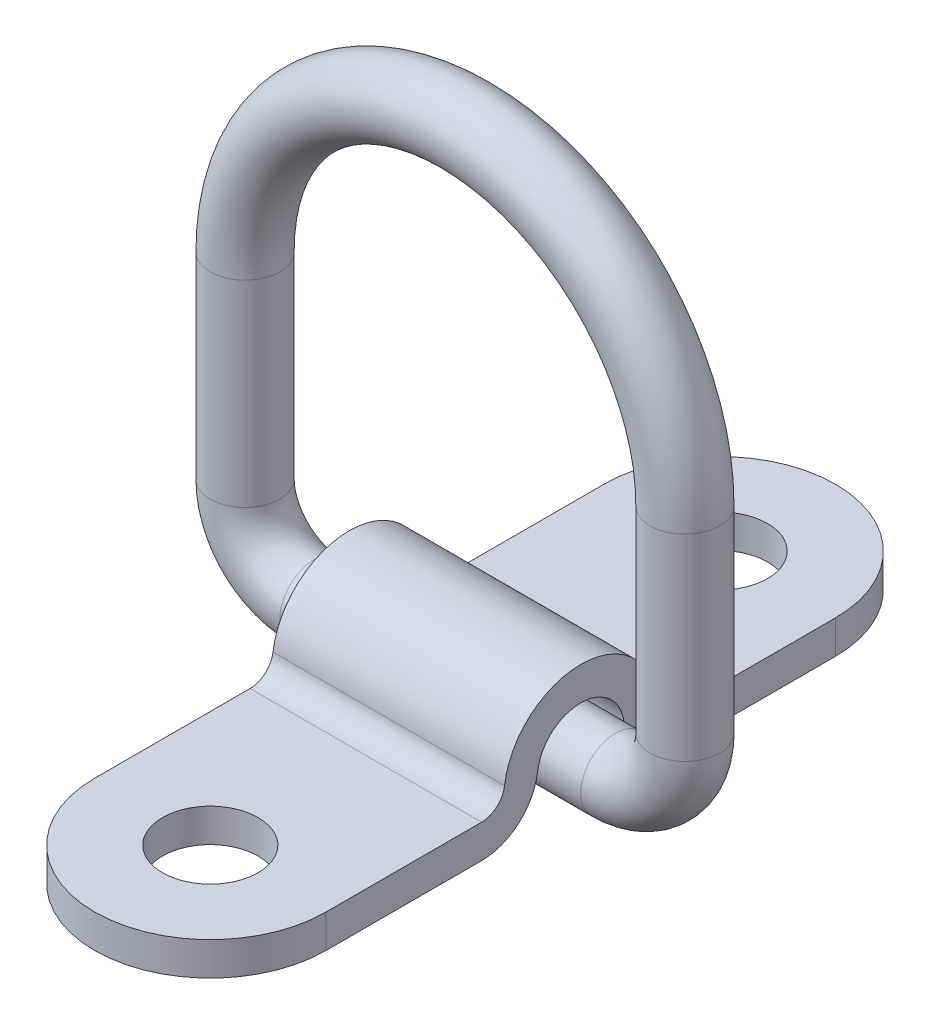
from build123d import *

# Parameters (mm, degrees)
SKETCH2_R           = 2.38125
BOSS_EXTRUDE1_DEPTH = 7.9375
SKETCH4_R           = 3.2766
CUT_EXTRUDE1_DEPTH  = 50.477676563


with BuildPart() as part:
    # Sweep1: sweep along a path in Sketch1
    with BuildLine(Plane.XY) as sweep1_path:
        Line((-15.08125, 18.25625), (-15.08125, 4.7625))
        ThreePointArc((-15.08125, 4.7625), (-13.686346045, 1.394903955), (-10.31875, 0))
        Line((-10.31875, 0), (10.31875, 0))
        ThreePointArc((10.31875, 0), (13.686346045, 1.394903955), (15.08125, 4.7625))
        Line((15.08125, 4.7625), (15.08125, 18.25625))
        ThreePointArc((15.08125, 18.25625), (0, 33.3375), (-15.08125, 18.25625))
    # Sketch2 → Sweep1 (sweep)
    with BuildSketch(Plane(origin=(0, 0, 0), x_dir=(0, 0, -1), z_dir=(1, 0, 0))):
        Circle(SKETCH2_R)
    sweep(path=sweep1_path.line)


with BuildPart() as body_2:
    # Sketch3 → Boss-Extrude1 (new, symmetric)
    with BuildSketch(Plane(origin=(0, 0, 0), x_dir=(0, 0, -1), z_dir=(1, 0, 0))):
        with BuildLine():
            Line((-25.4, -2.9845), (-6.800135513, -2.9845))
            ThreePointArc((-6.800135513, -2.9845), (-4.244843065, -2.022096486), (-2.959318233, 0.38687963))
            ThreePointArc((-2.959318233, 0.38687963), (0, 2.9845), (2.959318233, 0.38687963))
            ThreePointArc((2.959318233, 0.38687963), (4.244843065, -2.022096486), (6.800135513, -2.9845))
            Line((6.800135513, -2.9845), (25.4, -2.9845))
            Line((25.4, -2.9845), (25.4, -0.6985))
            Line((25.4, -0.6985), (6.800135513, -0.6985))
            ThreePointArc((6.800135513, -0.6985), (5.75288451, -0.30407233), (5.22603007, 0.683212963))
            ThreePointArc((5.22603007, 0.683212963), (0, 5.2705), (-5.22603007, 0.683212963))
            ThreePointArc((-5.22603007, 0.683212963), (-5.75288451, -0.30407233), (-6.800135513, -0.6985))
            Line((-6.800135513, -0.6985), (-25.4, -0.6985))
            Line((-25.4, -0.6985), (-25.4, -2.9845))
        make_face()
    extrude(amount=BOSS_EXTRUDE1_DEPTH, both=True)

    # Sketch4 → Cut-Extrude1 (cut, through all)
    with BuildSketch(Plane.XZ.offset(2.9845)):
        with Locations((0, 17.4625)):
            Circle(SKETCH4_R)
        with Locations((0, -17.4625)):
            Circle(SKETCH4_R)
        with BuildLine():
            Line((-7.9375, 17.4625), (-7.9375, 25.4))
            Line((-7.9375, 25.4), (-7.9375, 26.67))
            Line((-7.9375, 26.67), (7.9375, 26.67))
            Line((7.9375, 26.67), (7.9375, 25.4))
            Line((7.9375, 25.4), (7.9375, 17.4625))
            ThreePointArc((7.9375, 17.4625), (0, 25.4), (-7.9375, 17.4625))
        make_face()
        with BuildLine():
            Line((7.9375, -25.4), (7.9375, -17.4625))
            ThreePointArc((7.9375, -17.4625), (0, -25.4), (-7.9375, -17.4625))
            Line((-7.9375, -17.4625), (-7.9375, -25.4))
            Line((-7.9375, -25.4), (-7.9375, -26.67))
            Line((-7.9375, -26.67), (7.9375, -26.67))
            Line((7.9375, -26.67), (7.9375, -25.4))
        make_face()
    extrude(amount=-CUT_EXTRUDE1_DEPTH, mode=Mode.SUBTRACT)


solid = Compound([part.part, body_2.part])
